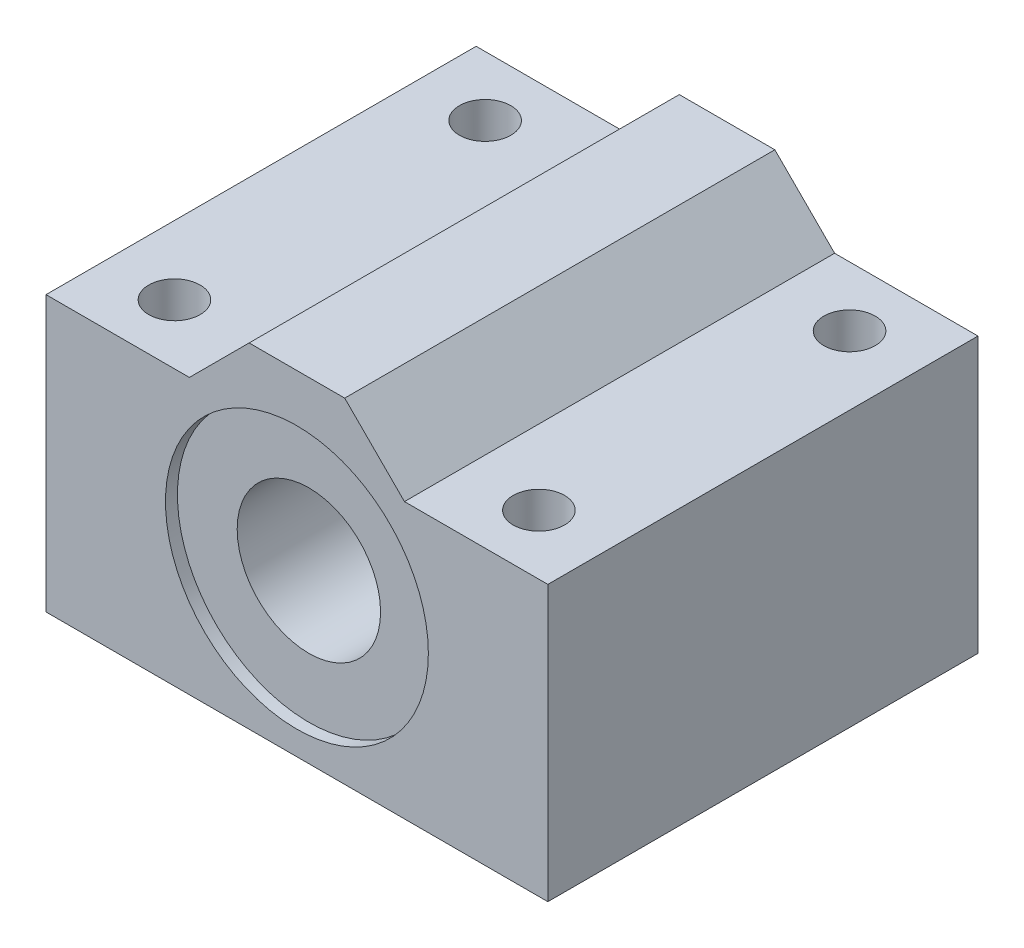
from build123d import *

# Parameters (mm, degrees)
SKETCH1_W           = 42
SKETCH1_H           = 28
SKETCH1_R           = 6
BOSS_EXTRUDE1_DEPTH = 18
CUT_EXTRUDE5_DEPTH  = 44.965895874
SKETCH2_R           = 2.15
CUT_EXTRUDE1_DEPTH  = 40.357337308
SKETCH3_R           = 2.5
CUT_EXTRUDE2_DEPTH  = 12
SKETCH4_R           = 11
CUT_EXTRUDE3_DEPTH  = 1
CUT_EXTRUDE4_START  = -1
SKETCH5_R           = 11
CUT_EXTRUDE4_DEPTH  = 1


with BuildPart() as part:
    # Sketch1 → Boss-Extrude1 (new, symmetric)
    with BuildSketch(Plane.XY):
        Rectangle(SKETCH1_W, SKETCH1_H)
        with Locations((0, -1)):
            Circle(SKETCH1_R, mode=Mode.SUBTRACT)
    extrude(amount=BOSS_EXTRUDE1_DEPTH, both=True)

    # Sketch6 → Cut-Extrude5 (cut, through all)
    with BuildSketch(Plane.XY.offset(18)):
        Polygon((-21, 9), (-9, 9), (-4, 14), (-21, 14), align=None)
        Polygon((21, 9), (9, 9), (4, 14), (21, 14), align=None)
    extrude(amount=-CUT_EXTRUDE5_DEPTH, mode=Mode.SUBTRACT)

    # Sketch2 → Cut-Extrude1 (cut, through all)
    with BuildSketch(Plane(origin=(0, -14, 0), x_dir=(-1, 0, 0), z_dir=(0, -1, 0))):
        with Locations((15.25, -13)):
            Circle(SKETCH2_R)
        with Locations((-15.25, -13)):
            Circle(SKETCH2_R)
        with Locations((-15.25, 13)):
            Circle(SKETCH2_R)
        with Locations((15.25, 13)):
            Circle(SKETCH2_R)
    extrude(amount=-CUT_EXTRUDE1_DEPTH, mode=Mode.SUBTRACT)

    # Sketch3 → Cut-Extrude2 (cut)
    with BuildSketch(Plane.XZ.offset(14)):
        with Locations((-15.25, 13)):
            Circle(SKETCH3_R)
        with Locations((15.25, 13)):
            Circle(SKETCH3_R)
        with Locations((15.25, -13)):
            Circle(SKETCH3_R)
        with Locations((-15.25, -13)):
            Circle(SKETCH3_R)
    extrude(amount=-CUT_EXTRUDE2_DEPTH, mode=Mode.SUBTRACT)

    # Sketch4 → Cut-Extrude3 (cut)
    with BuildSketch(Plane.XY.offset(18)):
        with Locations((0, -1)):
            Circle(SKETCH4_R)
    extrude(amount=-CUT_EXTRUDE3_DEPTH, mode=Mode.SUBTRACT)

    # Sketch5 → Cut-Extrude4 (cut)
    with BuildSketch(Plane(origin=(0, 0, -18), x_dir=(-1, 0, 0), z_dir=(0, 0, -1)).offset(CUT_EXTRUDE4_START)):
        with Locations((0, -1)):
            Circle(SKETCH5_R)
    extrude(amount=CUT_EXTRUDE4_DEPTH, mode=Mode.SUBTRACT)


solid = part.part
